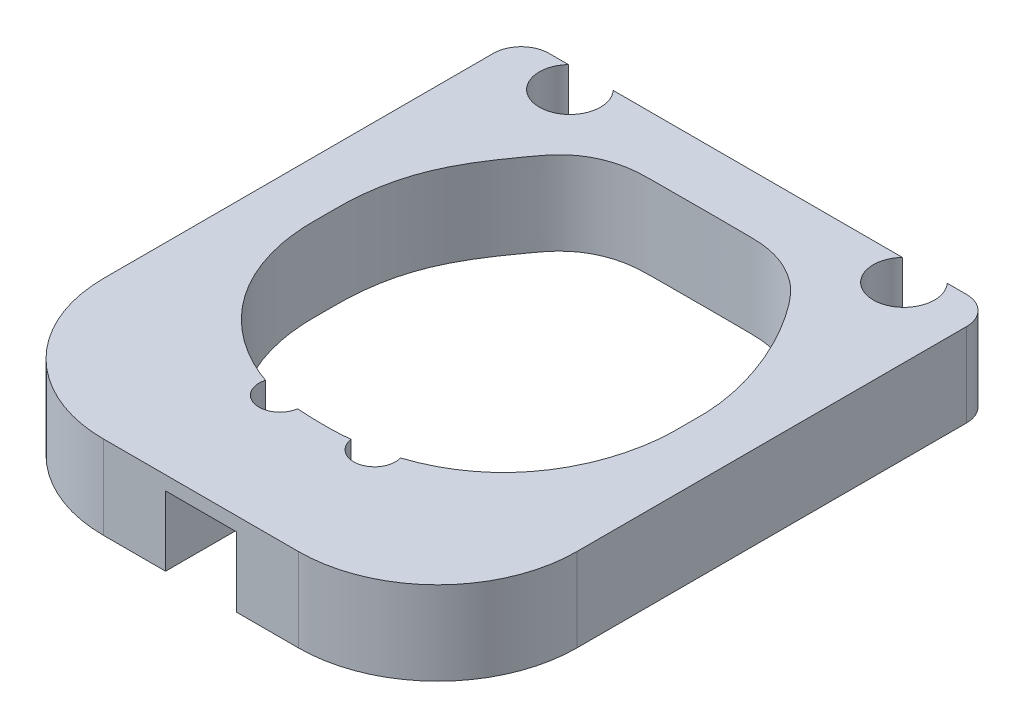
from build123d import *

# Parameters (mm, degrees)
BOSS_EXTRU_1_DEPTH      = 3
ESQUISSE3_R             = 0.75
ENL_V_MAT_EXTRU_1_DEPTH = 3
ESQUISSE4_W             = 2.55
ESQUISSE4_H             = 2.5
ENL_V_MAT_EXTRU_2_DEPTH = 2.5
ENL_V_MAT_EXTRU_3_REACH = 16.221


with BuildPart() as part:
    # Esquisse1 → Boss.-Extru.1 (new body)
    with BuildSketch(Plane(origin=(0, 0, 0), x_dir=(1, 0, 0), z_dir=(0, 1, 0))):
        with BuildLine():
            Line((-7.5, 9), (7.5, 9))
            ThreePointArc((7.5, 9), (8.207106781, 8.707106781), (8.5, 8))
            Line((8.5, 8), (8.5, -6))
            ThreePointArc((8.5, -6), (7.035533906, -9.535533906), (3.5, -11))
            Line((3.5, -11), (-3.5, -11))
            ThreePointArc((-3.5, -11), (-7.035533906, -9.535533906), (-8.5, -6))
            Line((-8.5, -6), (-8.5, 8))
            ThreePointArc((-8.5, 8), (-8.207106781, 8.707106781), (-7.5, 9))
        make_face()
        with BuildLine():
            add(Edge.make_bspline(
                [(-6.5, 0.021425618), (-6.565063138, 2.578432336), (-5.632782381, 4.102553172), (-3.903676203, 6.446852428), (-2.758160831, 6.899276222), (-0.878751888, 6.912168393), (1.130065999, 6.9136657), (2.762387867, 6.894575989), (3.913312434, 6.393724296), (5.683837223, 4.182928225), (6.55481217, 1.824257749), (6.494321325, -0.006355754), (6.512385425, -0.674969758), (6.245604325, -3.43668929), (4.325324504, -6.182451815), (0.542300843, -6.620044185), (-0.424881736, -6.607450435), (-3.091157441, -6.478339187), (-6.122763326, -4.404044401), (-6.516967238, -0.772884176), (-6.493763894, -0.201339557), (-6.499435316, -0.000766677), (-6.5, 0.021425618)],
                knots=[0, 0, 0, 0, 0.112371839, 0.130275732, 0.173620802, 0.187168536, 0.252205347, 0.266940035, 0.319780728, 0.343419676, 0.479690568, 0.498676785, 0.51429563, 0.54296722, 0.756721096, 0.785787005, 0.804560399, 0.825241089, 0.971913217, 0.99122251, 0.999024723, 1, 1, 1, 1], degree=3))
        make_face(mode=Mode.SUBTRACT)
    extrude(amount=BOSS_EXTRU_1_DEPTH)

    # Esquisse3 → Enlèv. mat.-Extru.1 (cut)
    with BuildSketch(Plane(origin=(0, 3, 0), x_dir=(1, 0, 0), z_dir=(0, 1, 0))):
        with Locations((-1.7, -6.467685331)):
            Circle(ESQUISSE3_R)
        with Locations((1.7, -6.467685331)):
            Circle(ESQUISSE3_R)
    extrude(amount=-ENL_V_MAT_EXTRU_1_DEPTH, mode=Mode.SUBTRACT)

    # Esquisse4 → Enlèv. mat.-Extru.2 (cut)
    with BuildSketch(Plane.XZ):
        with Locations((0, 9.75)):
            Rectangle(ESQUISSE4_W, ESQUISSE4_H)
    extrude(amount=-ENL_V_MAT_EXTRU_2_DEPTH, mode=Mode.SUBTRACT)

    # Esquisse4<3> → Enlèv. mat.-Extru.3 (cut, up to next)
    with BuildSketch(Plane.XZ, mode=Mode.PRIVATE) as enl_v_mat_extru_3_sk1:
        with BuildLine():
            ThreePointArc((-5.195326153, -9), (-6, -7.15), (-6.804673847, -9))
            Line((-6.804673847, -9), (-5.195326153, -9))
        make_face()
    enl_v_mat_extru_3_tool1 = extrude(enl_v_mat_extru_3_sk1.sketch, amount=-ENL_V_MAT_EXTRU_3_REACH, mode=Mode.PRIVATE) & part.part
    # Esquisse4<3> → Enlèv. mat.-Extru.3 (cut, up to next)
    with BuildSketch(Plane.XZ, mode=Mode.PRIVATE) as enl_v_mat_extru_3_sk2:
        with BuildLine():
            ThreePointArc((6.804673847, -9), (6, -7.15), (5.195326153, -9))
            Line((5.195326153, -9), (6.804673847, -9))
        make_face()
    enl_v_mat_extru_3_tool2 = extrude(enl_v_mat_extru_3_sk2.sketch, amount=-ENL_V_MAT_EXTRU_3_REACH, mode=Mode.PRIVATE) & part.part
    add(enl_v_mat_extru_3_tool1.solids().sort_by_distance((-6, 0, -8.148196))[0], mode=Mode.SUBTRACT)
    add(enl_v_mat_extru_3_tool2.solids().sort_by_distance((6, 0, -8.148196))[0], mode=Mode.SUBTRACT)


solid = part.part
